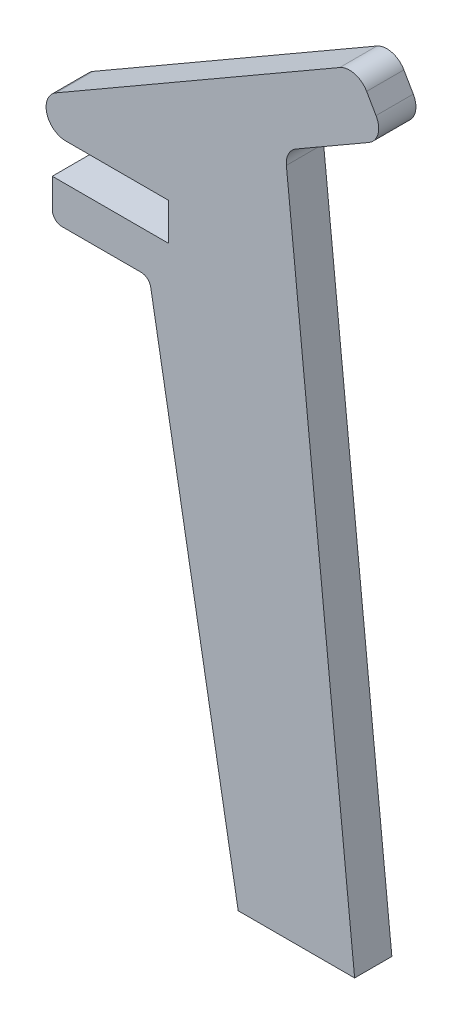
from build123d import *

# Parameters (mm, degrees)
BOSS_EXTRUDE1_DEPTH = 6.096
FILLET1_R           = 6.45
FILLET2_R           = 3.175


with BuildPart() as part:
    # Sketch1 → Boss-Extrude1 (new, symmetric)
    with BuildSketch(Plane.XY):
        Polygon((159.995567884, -83.885938074), (150.470567884, -67.388154132), (31.146005713, -136.280222222), (88.9, -136.280222222), (88.9, -148.472222222), (50.8, -148.472222222), (50.8, -161.172222222), (82.55, -161.172222222), (111.661584515, -326.272222222), (149.761584515, -326.272222222), (127, -102.935938074), align=None)
    extrude(amount=BOSS_EXTRUDE1_DEPTH, both=True)

    # Fillet1
    fillet1_edges = [part.edges().sort_by_distance(p)[0] for p in [
        (31.146005713, -136.280222222, 0),
        (127, -102.935938074, 0),
        (150.470567884, -67.388154132, 0),
        (159.995567884, -83.885938074, 0),
    ]]
    fillet(fillet1_edges, radius=FILLET1_R)

    # Fillet2
    fillet2_edges = [part.edges().sort_by_distance(p)[0] for p in [
        (82.55, -161.172222222, 0),
        (50.8, -161.172222222, 0),
    ]]
    fillet(fillet2_edges, radius=FILLET2_R)


solid = part.part
